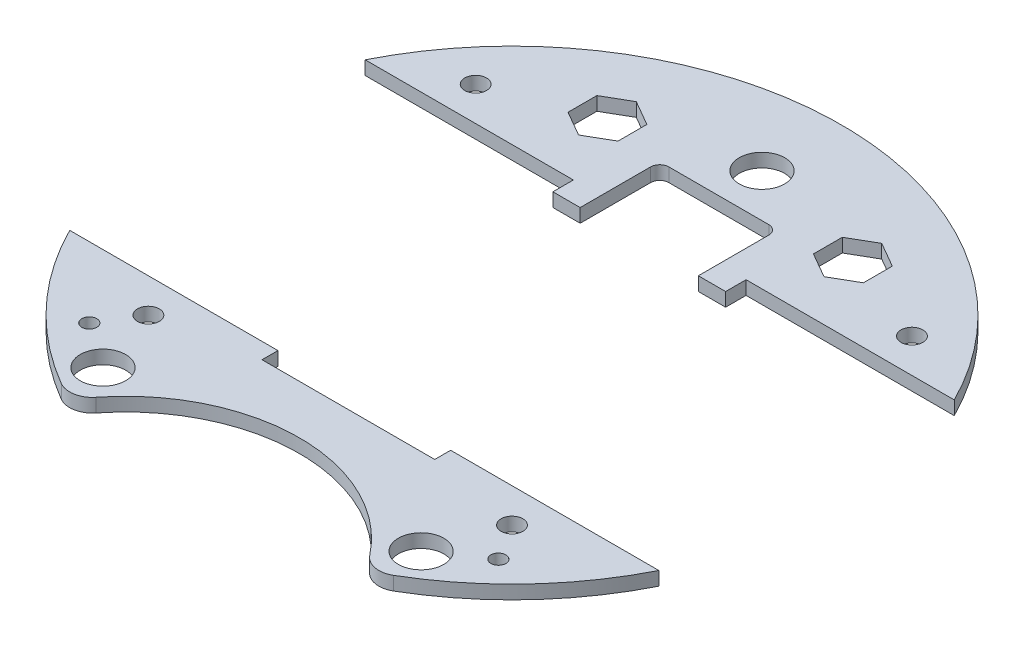
from build123d import *

# Parameters (mm, degrees)
BOSS_EXTRUDE1_DEPTH  = 3
SOLENOID_PLACEMENT_W = 38
SOLENOID_PLACEMENT_H = 64
CUT_EXTRUDE1_DEPTH   = 103.574363269
CUT_EXTRUDE4_DEPTH   = 103.574363269
CUT_EXTRUDE5_DEPTH   = 103.574363269
SKETCH6_R            = 2.4
CUT_EXTRUDE6_DEPTH   = 103.574363269
CUT_EXTRUDE3_DEPTH   = 103.574363269
SKETCH7_R            = 5
CUT_EXTRUDE7_DEPTH   = 98.289516393
SKETCH8_R            = 5
CUT_EXTRUDE9_DEPTH   = 98.289516393
SKETCH9_R            = 1.65
CUT_EXTRUDE10_DEPTH  = 98.289516393


with BuildPart() as part:
    # Sketch1 → Boss-Extrude1 (new body)
    with BuildSketch(Plane(origin=(0, 0, 0), x_dir=(1, 0, 0), z_dir=(0, 1, 0))):
        with BuildLine():
            ThreePointArc((36.543377003, -62.616544118), (0, 72.5), (-36.543377003, -62.616544118))
            ThreePointArc((-36.543377003, -62.616544118), (-33.085954668, -63.20954405), (-30.089832649, -61.38507948))
            ThreePointArc((-30.089832649, -61.38507948), (0, -46.75), (30.089832649, -61.38507948))
            ThreePointArc((30.089832649, -61.38507948), (33.085954668, -63.20954405), (36.543377003, -62.616544118))
        make_face()
    extrude(amount=BOSS_EXTRUDE1_DEPTH)

    # solenoid placement → Cut-Extrude1 (cut, through all)
    with BuildSketch(Plane(origin=(0, 3, 0), x_dir=(1, 0, 0), z_dir=(0, 1, 0))):
        with Locations((0, -4)):
            Rectangle(SOLENOID_PLACEMENT_W, SOLENOID_PLACEMENT_H)
    extrude(amount=-CUT_EXTRUDE1_DEPTH, mode=Mode.SUBTRACT)

    # Sketch4 → Cut-Extrude4 (cut, through all)
    with BuildSketch(Plane(origin=(0, 3, 0), x_dir=(1, 0, 0), z_dir=(0, 1, 0))):
        with BuildLine():
            Line((13, 28), (13, 43.5))
            ThreePointArc((13, 43.5), (12.414213562, 44.914213562), (11, 45.5))
            Line((11, 45.5), (-11, 45.5))
            ThreePointArc((-11, 45.5), (-12.414213562, 44.914213562), (-13, 43.5))
            Line((-13, 43.5), (-13, 28))
            Line((-13, 28), (13, 28))
        make_face()
    extrude(amount=-CUT_EXTRUDE4_DEPTH, mode=Mode.SUBTRACT)

    # Sketch5 → Cut-Extrude5 (cut, through all)
    with BuildSketch(Plane(origin=(0, 3, 0), x_dir=(1, 0, 0), z_dir=(0, 1, 0))):
        Polygon((-21.5, 51.175426481), (-27, 54.350852961), (-32.5, 51.175426481), (-32.5, 44.824573519), (-27, 41.649147039), (-21.5, 44.824573519), align=None)
        Polygon((21.5, 51.175426481), (21.5, 44.824573519), (27, 41.649147039), (32.5, 44.824573519), (32.5, 51.175426481), (27, 54.350852961), align=None)
    extrude(amount=-CUT_EXTRUDE5_DEPTH, mode=Mode.SUBTRACT)

    # Sketch6 → Cut-Extrude6 (cut, through all)
    with BuildSketch(Plane(origin=(0, 3, 0), x_dir=(1, 0, 0), z_dir=(0, 1, 0))):
        with Locations((40, -40)):
            Circle(SKETCH6_R)
        with Locations((-40, -40)):
            Circle(SKETCH6_R)
        with Locations((48, 40)):
            Circle(SKETCH6_R)
        with Locations((-48, 40)):
            Circle(SKETCH6_R)
    extrude(amount=-CUT_EXTRUDE6_DEPTH, mode=Mode.SUBTRACT)

    # Sketch3 → Cut-Extrude3 (cut, through all)
    with BuildSketch(Plane(origin=(0, 3, 0), x_dir=(1, 0, 0), z_dir=(0, 1, 0))):
        Polygon((-19, 28), (-19, 32.5), (-72.5, 32.5), (-72.5, -32.5), (72.5, -32.5), (72.5, 32.5), (19, 32.5), (19, 28), align=None)
    extrude(amount=-CUT_EXTRUDE3_DEPTH, mode=Mode.SUBTRACT)


with BuildPart() as cut_extrude3_piece_1:
    # of the separate pieces the step leaves, piece 1, a body of its own (cut_extrude3_pieces)
    add(part.part.solids().sort_by_distance((64.807406984, 0, -32.5))[0])

    # Sketch8 → Cut-Extrude9 (cut, through all)
    with BuildSketch(Plane.XZ.offset(-3)):
        with Locations((0, -55)):
            Circle(SKETCH8_R)
    extrude(amount=CUT_EXTRUDE9_DEPTH, mode=Mode.SUBTRACT)


with BuildPart() as cut_extrude3_piece_2:
    # of the separate pieces the step leaves, piece 2, a body of its own (cut_extrude3_pieces)
    add(part.part.solids().sort_by_distance((-36.543377003, 0, 62.616544118))[0])

    # Sketch7 → Cut-Extrude7 (cut, through all)
    with BuildSketch(Plane(origin=(0, 3, 0), x_dir=(1, 0, 0), z_dir=(0, 1, 0))):
        with Locations((35, -55)):
            Circle(SKETCH7_R)
        with Locations((-35, -55)):
            Circle(SKETCH7_R)
    extrude(amount=-CUT_EXTRUDE7_DEPTH, mode=Mode.SUBTRACT)

    # Sketch9 → Cut-Extrude10 (cut, through all)
    with BuildSketch(Plane(origin=(0, 3, 0), x_dir=(1, 0, 0), z_dir=(0, 1, 0))):
        with Locations((45, -48)):
            Circle(SKETCH9_R)
        with Locations((-45, -48)):
            Circle(SKETCH9_R)
    extrude(amount=-CUT_EXTRUDE10_DEPTH, mode=Mode.SUBTRACT)


solid = Compound([cut_extrude3_piece_1.part, cut_extrude3_piece_2.part])
